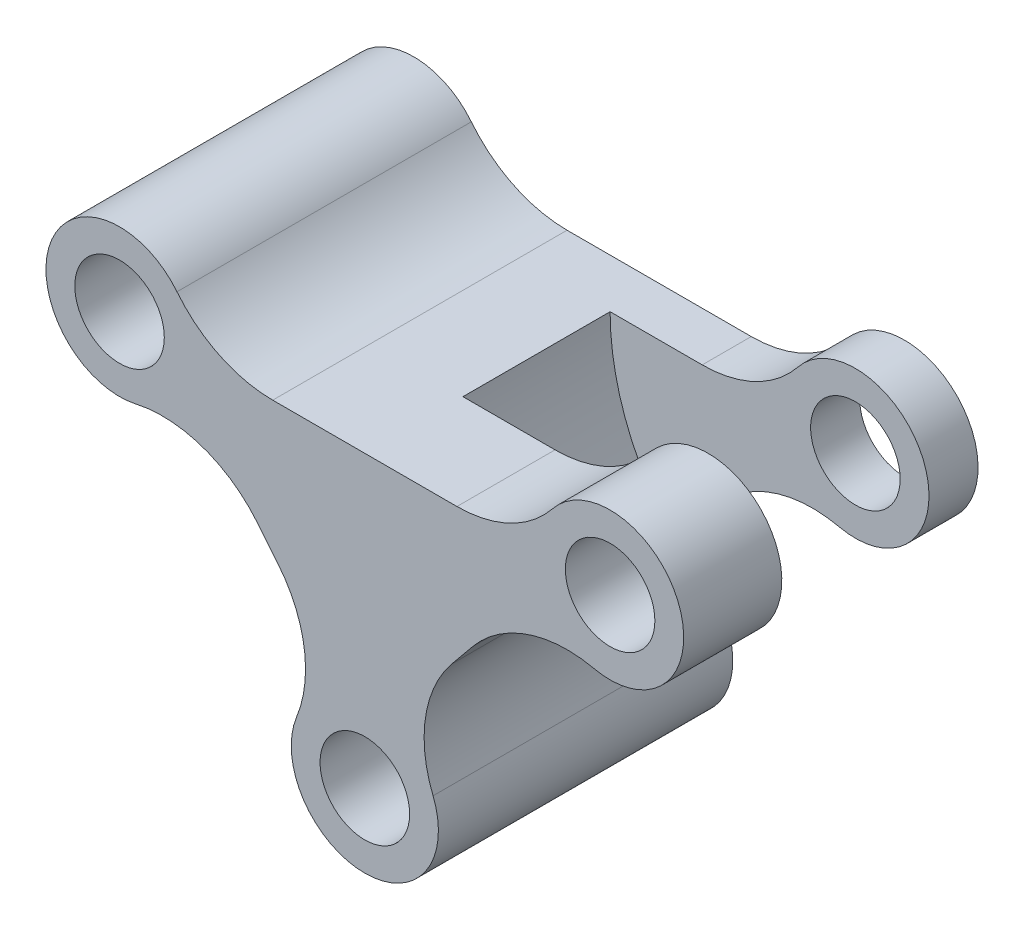
from build123d import *

# Parameters (mm, degrees)
ESQUISSE2_R             = 3
ESQUISSE2_R_2           = 1.825
BOSS_EXTRU_1_DEPTH      = 12
ESQUISSE3_R             = 10
ENL_V_MAT_EXTRU_1_DEPTH = 6
CONG_1_R                = 5
FILLET1_R               = 5


with BuildPart() as part:
    # Esquisse2 → Boss.-Extru.1 (new body)
    # profile 1 of 4: a face of its own
    with BuildSketch(Plane.XY):
        with Locations((-10, 5)):
            Circle(ESQUISSE2_R)
        with Locations((-10, 5)):
            Circle(ESQUISSE2_R_2, mode=Mode.SUBTRACT)
    # profile 2 of 4: a face of its own
    with BuildSketch(Plane.XY):
        with Locations((10, 5)):
            Circle(ESQUISSE2_R)
        with Locations((10, 5)):
            Circle(ESQUISSE2_R_2, mode=Mode.SUBTRACT)
    # profile 3 of 4: a face of its own
    with BuildSketch(Plane.XY):
        with Locations((0, -6.825)):
            Circle(ESQUISSE2_R)
        with Locations((0, -6.825)):
            Circle(ESQUISSE2_R_2, mode=Mode.SUBTRACT)
    # profile 4 of 4: a face of its own
    with BuildSketch(Plane.XY):
        Polygon((-8.175, 5), (8.175, 5), (0, -5), align=None)
    extrude(amount=BOSS_EXTRU_1_DEPTH)

    # Esquisse3 → Enlèv. mat.-Extru.1 (cut)
    with BuildSketch(Plane.XY.offset(2)):
        with Locations((10, 5)):
            Circle(ESQUISSE3_R)
    extrude(amount=ENL_V_MAT_EXTRU_1_DEPTH, mode=Mode.SUBTRACT)

    # Congé1
    # the kernel refuses this fillet: 5 mm, written as the material it adds along each edge
    with BuildSketch(Plane(origin=(-7, 5, 0), x_dir=(-0.3311912213512006, 0.9435636570469954, 0), z_dir=(0, 0, 1))) as cong_1_piece_1:
        with BuildLine():
            CenterArc((3.643103435, -4.717818285), CONG_1_R, 109.341093727, 51.317812547)
            Line((-1.07471485, -3.061862178), (0, 0))
            ThreePointArc((0, 0), (0.993573664, -0.169309029), (1.987147328, 0))
        make_face()
    extrude(amount=12)
    with BuildSketch(Plane(origin=(-7.231093941, 3.845374851, 12), x_dir=(-0.7661000074497634, -0.6427213848826507, 0), z_dir=(0, 0, -1))) as cong_1_piece_2:
        with BuildLine():
            CenterArc((5.056907819, -4.440322454), CONG_1_R, 117.368969646, 63.360078756)
            Line((0.057312583, -4.503942212), (0, 0))
            ThreePointArc((0, 0), (1.379156678, -0.335806528), (2.758313356, 0))
        make_face()
    extrude(amount=12)
    with BuildSketch(Plane(origin=(-0.858096974, -3.950340093, 12), x_dir=(-0.6329215353519139, 0.7742159453846039, 0), z_dir=(0, 0, -1))) as cong_1_piece_3:
        with BuildLine():
            CenterArc((4.246739065, -5), CONG_1_R, 90, 61.27443838)
            ThreePointArc((-0.137920096, -2.596926126), (0.227062491, -1.314184518), (0, 0))
            Line((0, 0), (4.246739065, 0))
        make_face()
    extrude(amount=12)
    with BuildSketch(Plane(origin=(7.231093941, 3.845374851, 12), x_dir=(-0.6329215353519138, -0.774215945384604, 0), z_dir=(0, 0, -1))) as cong_1_piece_4:
        with BuildLine():
            CenterArc((4.504306848, -5), CONG_1_R, 90, 63.360078756)
            ThreePointArc((0.035096646, -2.758090063), (0.353327666, -1.374772245), (0, 0))
            Line((0, 0), (4.504306848, 0))
        make_face()
    extrude(amount=4)
    with BuildSketch(Plane(origin=(7, 5, 12), x_dir=(-1, 0, 0), z_dir=(0, 0, -1))) as cong_1_piece_5:
        with BuildLine():
            CenterArc((3.244997998, 5), CONG_1_R, 218.682187453, 51.317812547)
            ThreePointArc((-0.658125751, 1.875), (-0.169309029, 0.993573664), (0, 0))
            Line((0, 0), (3.244997998, 0))
        make_face()
    extrude(amount=4)
    with BuildSketch(Plane(origin=(0.858096974, -3.950340093, 12), x_dir=(0.7395598752725667, -0.6730907746261462, 0), z_dir=(0, 0, -1))) as cong_1_piece_6_section:
        with BuildLine():
            CenterArc((4.767740899, -4.505933799), CONG_1_R, 115.685497342, 61.27443838)
            Line((-0.225222573, -4.240762606), (0, 0))
            ThreePointArc((0, 0), (1.300292973, -0.29643972), (2.600585945, 0))
        make_face()
    cong_1_piece_6 = extrude(amount=12, mode=Mode.PRIVATE)
    cong_1_piece_6 = cong_1_piece_6 - Plane(origin=(10, 5, 10), x_dir=(1, 0, 0), z_dir=(0, 0, -1)) * Cylinder(10, 41, mode=Mode.PRIVATE)
    add(cong_1_piece_6)
    with BuildSketch(Plane(origin=(0.858096974, -3.950340093, 12), x_dir=(0.7395598752725667, -0.6730907746261462, 0), z_dir=(0, 0, -1))) as cong_1_piece_7_section:
        with BuildLine():
            CenterArc((4.767740899, -4.505933799), CONG_1_R, 115.685497342, 61.27443838)
            Line((-0.225222573, -4.240762606), (0, 0))
            ThreePointArc((0, 0), (1.300292973, -0.29643972), (2.600585945, 0))
        make_face()
    cong_1_piece_7 = extrude(amount=22.616847663, mode=Mode.PRIVATE)
    cong_1_piece_7 = split(cong_1_piece_7, bisect_by=Plane(origin=(2.909028405, -1.544063306, 8), z_dir=(0, 0, 1)), keep=Keep.TOP, mode=Mode.PRIVATE)
    add(cong_1_piece_7)
    with BuildSketch(Plane(origin=(0.858096974, -3.950340093, 22.616847663), x_dir=(0.7395598752725666, -0.6730907746261463, 0), z_dir=(0, 0, -1))) as cong_1_piece_8_section:
        with BuildLine():
            CenterArc((4.767740899, -4.505933799), CONG_1_R, 115.685497342, 61.27443838)
            Line((-0.225222573, -4.240762606), (0, 0))
            ThreePointArc((0, 0), (1.300292973, -0.29643972), (2.600585945, 0))
        make_face()
    cong_1_piece_8 = extrude(amount=22.616847663, mode=Mode.PRIVATE)
    cong_1_piece_8 = split(cong_1_piece_8, bisect_by=Plane(origin=(2.909028405, -1.544063306, 2), z_dir=(0, 0, -1)), keep=Keep.TOP, mode=Mode.PRIVATE)
    add(cong_1_piece_8)

    # Fillet1
    fillet1_edges = [part.edges().sort_by_distance(p)[0] for p in [
        (7.231093941, 3.845374851, 1),
        (7, 5, 1),
    ]]
    fillet(fillet1_edges, radius=FILLET1_R)


solid = part.part
